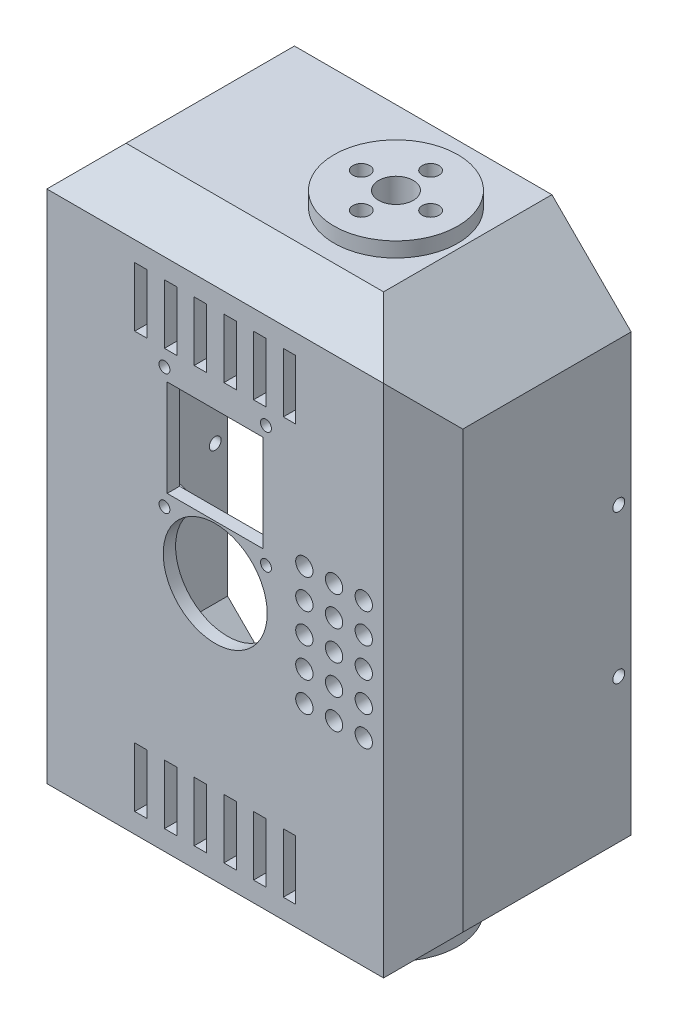
from build123d import *

# Parameters (mm, degrees)
BOSS_1_DEPTH    = 42
CUT_2_DEPTH     = 86
CUT_3_DEPTH     = 86
CUT_4_DEPTH     = 122
CUT_5_DEPTH     = 122
CUT_6_DEPTH     = 31.6
CUT_7_DEPTH     = 4.1
CUT_8_DEPTH     = 4.1
S_CUT9_W        = 2.5
S_CUT9_H        = 12
POCKET_9_DEPTH  = 2.7
S_CUT10_W       = 2.5
S_CUT10_H       = 12
POCKET_10_DEPTH = 2.7
S_CUT11_W       = 2.5
S_CUT11_H       = 12
POCKET_11_DEPTH = 2.7
S_CUT12_W       = 2.5
S_CUT12_H       = 12
POCKET_12_DEPTH = 2.7
S_CUT13_W       = 2.5
S_CUT13_H       = 12
POCKET_13_DEPTH = 2.7
S_CUT14_W       = 2.5
S_CUT14_H       = 12
POCKET_14_DEPTH = 2.7
S_HOLE15_R      = 1.2
HOLE_15_DEPTH   = 2.7
S_HOLE16_R      = 1.2
HOLE_16_DEPTH   = 2.7
S_CUT17_W       = 2.5
S_CUT17_H       = 12
POCKET_17_DEPTH = 2.7
S_CUT18_W       = 2.5
S_CUT18_H       = 12
POCKET_18_DEPTH = 2.7
S_CUT19_W       = 2.5
S_CUT19_H       = 12
POCKET_19_DEPTH = 2.7
S_CUT20_W       = 2.5
S_CUT20_H       = 12
POCKET_20_DEPTH = 2.7
S_CUT21_W       = 2.5
S_CUT21_H       = 12
POCKET_21_DEPTH = 2.7
S_CUT22_W       = 2.5
S_CUT22_H       = 12
POCKET_22_DEPTH = 2.7
S_HOLE23_R      = 1.2
HOLE_23_DEPTH   = 2.7
S_HOLE24_R      = 1.2
HOLE_24_DEPTH   = 2.7
S_HOLE25_R      = 1.75
HOLE_25_DEPTH   = 2.7
S_HOLE26_R      = 1.75
HOLE_26_DEPTH   = 2.7
S_HOLE27_R      = 1.75
HOLE_27_DEPTH   = 2.7
S_HOLE28_R      = 1.75
HOLE_28_DEPTH   = 2.7
S_HOLE29_R      = 1.75
HOLE_29_DEPTH   = 2.7
S_HOLE30_R      = 1.75
HOLE_30_DEPTH   = 2.7
S_HOLE31_R      = 1.75
HOLE_31_DEPTH   = 2.7
S_HOLE32_R      = 1.75
HOLE_32_DEPTH   = 2.7
S_HOLE33_R      = 1.75
HOLE_33_DEPTH   = 2.7
S_HOLE34_R      = 1.75
HOLE_34_DEPTH   = 2.7
S_HOLE35_R      = 1.75
HOLE_35_DEPTH   = 2.7
S_HOLE36_R      = 1.75
HOLE_36_DEPTH   = 2.7
S_HOLE37_R      = 1.75
HOLE_37_DEPTH   = 2.7
S_HOLE38_R      = 1.75
HOLE_38_DEPTH   = 2.7
S_HOLE39_R      = 1.75
HOLE_39_DEPTH   = 2.7
S_CYL40_R       = 12.5
BOSS_40_DEPTH   = 6
S_CYL41_R       = 12.5
BOSS_41_DEPTH   = 6
S_CYL42_R       = 2.5
BOSS_42_DEPTH   = 2
S_CYL43_R       = 2.5
BOSS_43_DEPTH   = 2
S_CYL44_R       = 2.5
BOSS_44_DEPTH   = 2
S_CYL45_R       = 2.5
BOSS_45_DEPTH   = 2
S_HOLE46_R      = 3.5
HOLE_46_DEPTH   = 6.2
S_HOLE47_R      = 1.7
HOLE_47_DEPTH   = 6.2
S_HOLE48_R      = 1.7
HOLE_48_DEPTH   = 6.2
S_HOLE49_R      = 1.7
HOLE_49_DEPTH   = 6.2
S_HOLE50_R      = 1.7
HOLE_50_DEPTH   = 6.2
S_HOLE51_R      = 3.2
HOLE_51_DEPTH   = 3.1
S_HOLE52_R      = 3.2
HOLE_52_DEPTH   = 3.1
S_HOLE53_R      = 3.2
HOLE_53_DEPTH   = 3.1
S_HOLE54_R      = 3.2
HOLE_54_DEPTH   = 3.1
S_HOLE55_R      = 3.5
HOLE_55_DEPTH   = 6.2
S_HOLE56_R      = 1.7
HOLE_56_DEPTH   = 6.2
S_HOLE57_R      = 1.7
HOLE_57_DEPTH   = 6.2
S_HOLE58_R      = 1.7
HOLE_58_DEPTH   = 6.2
S_HOLE59_R      = 1.7
HOLE_59_DEPTH   = 6.2
S_HOLE60_R      = 3.2
HOLE_60_DEPTH   = 3.1
S_HOLE61_R      = 3.2
HOLE_61_DEPTH   = 3.1
S_HOLE62_R      = 3.2
HOLE_62_DEPTH   = 3.1
S_HOLE63_R      = 3.2
HOLE_63_DEPTH   = 3.1
S_HOLE64_R      = 10.5
HOLE_64_DEPTH   = 6.1
S_CUT65_W       = 19.4
S_CUT65_H       = 19.5
POCKET_65_DEPTH = 6.1
S_HOLE66_R      = 1.1
HOLE_66_DEPTH   = 3.2
S_HOLE67_R      = 1.1
HOLE_67_DEPTH   = 3.2
S_HOLE68_R      = 1.1
HOLE_68_DEPTH   = 3.2
S_HOLE69_R      = 1.1
HOLE_69_DEPTH   = 3.2


with BuildPart() as part:
    # S_prism1 → Boss_1 (new body)
    with BuildSketch(Plane.XY.offset(168)):
        Polygon((42, -44), (42, 44), (26, 60), (-26, 60), (-42, 44), (-42, -44), (-26, -60), (26, -60), align=None)
    extrude(amount=BOSS_1_DEPTH)

    # S_pcut2 → Cut_2 (cut)
    with BuildSketch(Plane(origin=(-43, 0, 0), x_dir=(0, 0, -1), z_dir=(1, 0, 0))):
        Polygon((-210.6, 60.6), (-210.6, 51.4), (-201.4, 60.6), align=None)
    extrude(amount=CUT_2_DEPTH, mode=Mode.SUBTRACT)

    # S_pcut3 → Cut_3 (cut)
    with BuildSketch(Plane(origin=(-43, 0, 0), x_dir=(0, 0, -1), z_dir=(1, 0, 0))):
        Polygon((-210.6, -60.6), (-210.6, -51.4), (-201.4, -60.6), align=None)
    extrude(amount=CUT_3_DEPTH, mode=Mode.SUBTRACT)

    # S_pcut4 → Cut_4 (cut)
    with BuildSketch(Plane(origin=(0, -61, 0), x_dir=(1, 0, 0), z_dir=(0, 1, 0))):
        Polygon((42.6, -210.6), (33.4, -210.6), (42.6, -201.4), align=None)
    extrude(amount=CUT_4_DEPTH, mode=Mode.SUBTRACT)

    # S_pcut5 → Cut_5 (cut)
    with BuildSketch(Plane(origin=(0, -61, 0), x_dir=(1, 0, 0), z_dir=(0, 1, 0))):
        Polygon((-42.6, -210.6), (-33.4, -210.6), (-42.6, -201.4), align=None)
    extrude(amount=CUT_5_DEPTH, mode=Mode.SUBTRACT)

    # S_pcut6 → Cut_6 (cut)
    with BuildSketch(Plane.XY.offset(167.9)):
        Polygon((39.5, -42.964466094), (39.5, 42.964466094), (24.964466094, 57.5), (-24.964466094, 57.5), (-39.5, 42.964466094), (-39.5, -42.964466094), (-24.964466094, -57.5), (24.964466094, -57.5), align=None)
    extrude(amount=CUT_6_DEPTH, mode=Mode.SUBTRACT)

    # S_pcut7 → Cut_7 (cut)
    with BuildSketch(Plane.XY.offset(199.4)):
        Polygon((35.5, -41.307611845), (35.5, 41.307611845), (23.307611845, 53.5), (-23.307611845, 53.5), (-35.5, 41.307611845), (-35.5, -41.307611845), (-23.307611845, -53.5), (23.307611845, -53.5), align=None)
    extrude(amount=CUT_7_DEPTH, mode=Mode.SUBTRACT)

    # S_pcut8 → Cut_8 (cut)
    with BuildSketch(Plane.XY.offset(203.4)):
        Polygon((31.5, -39.650757595), (31.5, 39.650757595), (21.650757595, 49.5), (-21.650757595, 49.5), (-31.5, 39.650757595), (-31.5, -39.650757595), (-21.650757595, -49.5), (21.650757595, -49.5), align=None)
    extrude(amount=CUT_8_DEPTH, mode=Mode.SUBTRACT)

    # S_cut9 → Pocket_9 (cut)
    with BuildSketch(Plane.XY.offset(207.4)):
        with Locations((-15, 42)):
            Rectangle(S_CUT9_W, S_CUT9_H)
    extrude(amount=POCKET_9_DEPTH, mode=Mode.SUBTRACT)

    # S_cut10 → Pocket_10 (cut)
    with BuildSketch(Plane.XY.offset(207.4)):
        with Locations((-9, 42)):
            Rectangle(S_CUT10_W, S_CUT10_H)
    extrude(amount=POCKET_10_DEPTH, mode=Mode.SUBTRACT)

    # S_cut11 → Pocket_11 (cut)
    with BuildSketch(Plane.XY.offset(207.4)):
        with Locations((-3, 42)):
            Rectangle(S_CUT11_W, S_CUT11_H)
    extrude(amount=POCKET_11_DEPTH, mode=Mode.SUBTRACT)

    # S_cut12 → Pocket_12 (cut)
    with BuildSketch(Plane.XY.offset(207.4)):
        with Locations((3, 42)):
            Rectangle(S_CUT12_W, S_CUT12_H)
    extrude(amount=POCKET_12_DEPTH, mode=Mode.SUBTRACT)

    # S_cut13 → Pocket_13 (cut)
    with BuildSketch(Plane.XY.offset(207.4)):
        with Locations((9, 42)):
            Rectangle(S_CUT13_W, S_CUT13_H)
    extrude(amount=POCKET_13_DEPTH, mode=Mode.SUBTRACT)

    # S_cut14 → Pocket_14 (cut)
    with BuildSketch(Plane.XY.offset(207.4)):
        with Locations((15, 42)):
            Rectangle(S_CUT14_W, S_CUT14_H)
    extrude(amount=POCKET_14_DEPTH, mode=Mode.SUBTRACT)

    # S_hole15 → Hole_15 (cut)
    with BuildSketch(Plane(origin=(39.4, 0, 0), x_dir=(0, 0, -1), z_dir=(1, 0, 0))):
        with Locations((-170.5, -15)):
            Circle(S_HOLE15_R)
    extrude(amount=HOLE_15_DEPTH, mode=Mode.SUBTRACT)

    # S_hole16 → Hole_16 (cut)
    with BuildSketch(Plane(origin=(39.4, 0, 0), x_dir=(0, 0, -1), z_dir=(1, 0, 0))):
        with Locations((-170.5, 15)):
            Circle(S_HOLE16_R)
    extrude(amount=HOLE_16_DEPTH, mode=Mode.SUBTRACT)

    # S_cut17 → Pocket_17 (cut)
    with BuildSketch(Plane.XY.offset(207.4)):
        with Locations((-15, -42)):
            Rectangle(S_CUT17_W, S_CUT17_H)
    extrude(amount=POCKET_17_DEPTH, mode=Mode.SUBTRACT)

    # S_cut18 → Pocket_18 (cut)
    with BuildSketch(Plane.XY.offset(207.4)):
        with Locations((-9, -42)):
            Rectangle(S_CUT18_W, S_CUT18_H)
    extrude(amount=POCKET_18_DEPTH, mode=Mode.SUBTRACT)

    # S_cut19 → Pocket_19 (cut)
    with BuildSketch(Plane.XY.offset(207.4)):
        with Locations((-3, -42)):
            Rectangle(S_CUT19_W, S_CUT19_H)
    extrude(amount=POCKET_19_DEPTH, mode=Mode.SUBTRACT)

    # S_cut20 → Pocket_20 (cut)
    with BuildSketch(Plane.XY.offset(207.4)):
        with Locations((3, -42)):
            Rectangle(S_CUT20_W, S_CUT20_H)
    extrude(amount=POCKET_20_DEPTH, mode=Mode.SUBTRACT)

    # S_cut21 → Pocket_21 (cut)
    with BuildSketch(Plane.XY.offset(207.4)):
        with Locations((9, -42)):
            Rectangle(S_CUT21_W, S_CUT21_H)
    extrude(amount=POCKET_21_DEPTH, mode=Mode.SUBTRACT)

    # S_cut22 → Pocket_22 (cut)
    with BuildSketch(Plane.XY.offset(207.4)):
        with Locations((15, -42)):
            Rectangle(S_CUT22_W, S_CUT22_H)
    extrude(amount=POCKET_22_DEPTH, mode=Mode.SUBTRACT)

    # S_hole23 → Hole_23 (cut)
    with BuildSketch(Plane(origin=(-42.1, 0, 0), x_dir=(0, 0, -1), z_dir=(1, 0, 0))):
        with Locations((-170.5, -15)):
            Circle(S_HOLE23_R)
    extrude(amount=HOLE_23_DEPTH, mode=Mode.SUBTRACT)

    # S_hole24 → Hole_24 (cut)
    with BuildSketch(Plane(origin=(-42.1, 0, 0), x_dir=(0, 0, -1), z_dir=(1, 0, 0))):
        with Locations((-170.5, 15)):
            Circle(S_HOLE24_R)
    extrude(amount=HOLE_24_DEPTH, mode=Mode.SUBTRACT)

    # S_hole25 → Hole_25 (cut)
    with BuildSketch(Plane.XY.offset(207.4)):
        with Locations((18, -12)):
            Circle(S_HOLE25_R)
    extrude(amount=HOLE_25_DEPTH, mode=Mode.SUBTRACT)

    # S_hole26 → Hole_26 (cut)
    with BuildSketch(Plane.XY.offset(207.4)):
        with Locations((18, -6)):
            Circle(S_HOLE26_R)
    extrude(amount=HOLE_26_DEPTH, mode=Mode.SUBTRACT)

    # S_hole27 → Hole_27 (cut)
    with BuildSketch(Plane.XY.offset(207.4)):
        with Locations((18, 0)):
            Circle(S_HOLE27_R)
    extrude(amount=HOLE_27_DEPTH, mode=Mode.SUBTRACT)

    # S_hole28 → Hole_28 (cut)
    with BuildSketch(Plane.XY.offset(207.4)):
        with Locations((18, 6)):
            Circle(S_HOLE28_R)
    extrude(amount=HOLE_28_DEPTH, mode=Mode.SUBTRACT)

    # S_hole29 → Hole_29 (cut)
    with BuildSketch(Plane.XY.offset(207.4)):
        with Locations((18, 12)):
            Circle(S_HOLE29_R)
    extrude(amount=HOLE_29_DEPTH, mode=Mode.SUBTRACT)

    # S_hole30 → Hole_30 (cut)
    with BuildSketch(Plane.XY.offset(207.4)):
        with Locations((24, -12)):
            Circle(S_HOLE30_R)
    extrude(amount=HOLE_30_DEPTH, mode=Mode.SUBTRACT)

    # S_hole31 → Hole_31 (cut)
    with BuildSketch(Plane.XY.offset(207.4)):
        with Locations((24, -6)):
            Circle(S_HOLE31_R)
    extrude(amount=HOLE_31_DEPTH, mode=Mode.SUBTRACT)

    # S_hole32 → Hole_32 (cut)
    with BuildSketch(Plane.XY.offset(207.4)):
        with Locations((24, 0)):
            Circle(S_HOLE32_R)
    extrude(amount=HOLE_32_DEPTH, mode=Mode.SUBTRACT)

    # S_hole33 → Hole_33 (cut)
    with BuildSketch(Plane.XY.offset(207.4)):
        with Locations((24, 6)):
            Circle(S_HOLE33_R)
    extrude(amount=HOLE_33_DEPTH, mode=Mode.SUBTRACT)

    # S_hole34 → Hole_34 (cut)
    with BuildSketch(Plane.XY.offset(207.4)):
        with Locations((24, 12)):
            Circle(S_HOLE34_R)
    extrude(amount=HOLE_34_DEPTH, mode=Mode.SUBTRACT)

    # S_hole35 → Hole_35 (cut)
    with BuildSketch(Plane.XY.offset(207.4)):
        with Locations((30, -12)):
            Circle(S_HOLE35_R)
    extrude(amount=HOLE_35_DEPTH, mode=Mode.SUBTRACT)

    # S_hole36 → Hole_36 (cut)
    with BuildSketch(Plane.XY.offset(207.4)):
        with Locations((30, -6)):
            Circle(S_HOLE36_R)
    extrude(amount=HOLE_36_DEPTH, mode=Mode.SUBTRACT)

    # S_hole37 → Hole_37 (cut)
    with BuildSketch(Plane.XY.offset(207.4)):
        with Locations((30, 0)):
            Circle(S_HOLE37_R)
    extrude(amount=HOLE_37_DEPTH, mode=Mode.SUBTRACT)

    # S_hole38 → Hole_38 (cut)
    with BuildSketch(Plane.XY.offset(207.4)):
        with Locations((30, 6)):
            Circle(S_HOLE38_R)
    extrude(amount=HOLE_38_DEPTH, mode=Mode.SUBTRACT)

    # S_hole39 → Hole_39 (cut)
    with BuildSketch(Plane.XY.offset(207.4)):
        with Locations((30, 12)):
            Circle(S_HOLE39_R)
    extrude(amount=HOLE_39_DEPTH, mode=Mode.SUBTRACT)

    # S_cyl40 → Boss_40 (add)
    with BuildSketch(Plane(origin=(0, 57, 0), x_dir=(1, 0, 0), z_dir=(0, 1, 0))):
        with Locations((12.5, -186)):
            Circle(S_CYL40_R)
    extrude(amount=BOSS_40_DEPTH)

    # S_cyl41 → Boss_41 (add)
    with BuildSketch(Plane(origin=(0, -63, 0), x_dir=(1, 0, 0), z_dir=(0, 1, 0))):
        with Locations((12.5, -186)):
            Circle(S_CYL41_R)
    extrude(amount=BOSS_41_DEPTH)

    # S_cyl42 → Boss_42 (add)
    with BuildSketch(Plane.XY.offset(207)):
        with Locations((-10.25, 8.3)):
            Circle(S_CYL42_R)
    extrude(amount=BOSS_42_DEPTH)

    # S_cyl43 → Boss_43 (add)
    with BuildSketch(Plane.XY.offset(207)):
        with Locations((10.25, 8.3)):
            Circle(S_CYL43_R)
    extrude(amount=BOSS_43_DEPTH)

    # S_cyl44 → Boss_44 (add)
    with BuildSketch(Plane.XY.offset(207)):
        with Locations((-10.25, 32.75)):
            Circle(S_CYL44_R)
    extrude(amount=BOSS_44_DEPTH)

    # S_cyl45 → Boss_45 (add)
    with BuildSketch(Plane.XY.offset(207)):
        with Locations((10.25, 32.75)):
            Circle(S_CYL45_R)
    extrude(amount=BOSS_45_DEPTH)

    # S_hole46 → Hole_46 (cut)
    with BuildSketch(Plane(origin=(0, 56.9, 0), x_dir=(1, 0, 0), z_dir=(0, 1, 0))):
        with Locations((12.5, -186)):
            Circle(S_HOLE46_R)
    extrude(amount=HOLE_46_DEPTH, mode=Mode.SUBTRACT)

    # S_hole47 → Hole_47 (cut)
    with BuildSketch(Plane(origin=(0, 56.9, 0), x_dir=(1, 0, 0), z_dir=(0, 1, 0))):
        with Locations((19.5, -186)):
            Circle(S_HOLE47_R)
    extrude(amount=HOLE_47_DEPTH, mode=Mode.SUBTRACT)

    # S_hole48 → Hole_48 (cut)
    with BuildSketch(Plane(origin=(0, 56.9, 0), x_dir=(1, 0, 0), z_dir=(0, 1, 0))):
        with Locations((12.5, -193)):
            Circle(S_HOLE48_R)
    extrude(amount=HOLE_48_DEPTH, mode=Mode.SUBTRACT)

    # S_hole49 → Hole_49 (cut)
    with BuildSketch(Plane(origin=(0, 56.9, 0), x_dir=(1, 0, 0), z_dir=(0, 1, 0))):
        with Locations((5.5, -186)):
            Circle(S_HOLE49_R)
    extrude(amount=HOLE_49_DEPTH, mode=Mode.SUBTRACT)

    # S_hole50 → Hole_50 (cut)
    with BuildSketch(Plane(origin=(0, 56.9, 0), x_dir=(1, 0, 0), z_dir=(0, 1, 0))):
        with Locations((12.5, -179)):
            Circle(S_HOLE50_R)
    extrude(amount=HOLE_50_DEPTH, mode=Mode.SUBTRACT)

    # S_hole51 → Hole_51 (cut)
    with BuildSketch(Plane(origin=(0, 56.9, 0), x_dir=(1, 0, 0), z_dir=(0, 1, 0))):
        with Locations((19.5, -186)):
            Circle(S_HOLE51_R)
    extrude(amount=HOLE_51_DEPTH, mode=Mode.SUBTRACT)

    # S_hole52 → Hole_52 (cut)
    with BuildSketch(Plane(origin=(0, 56.9, 0), x_dir=(1, 0, 0), z_dir=(0, 1, 0))):
        with Locations((12.5, -193)):
            Circle(S_HOLE52_R)
    extrude(amount=HOLE_52_DEPTH, mode=Mode.SUBTRACT)

    # S_hole53 → Hole_53 (cut)
    with BuildSketch(Plane(origin=(0, 56.9, 0), x_dir=(1, 0, 0), z_dir=(0, 1, 0))):
        with Locations((5.5, -186)):
            Circle(S_HOLE53_R)
    extrude(amount=HOLE_53_DEPTH, mode=Mode.SUBTRACT)

    # S_hole54 → Hole_54 (cut)
    with BuildSketch(Plane(origin=(0, 56.9, 0), x_dir=(1, 0, 0), z_dir=(0, 1, 0))):
        with Locations((12.5, -179)):
            Circle(S_HOLE54_R)
    extrude(amount=HOLE_54_DEPTH, mode=Mode.SUBTRACT)

    # S_hole55 → Hole_55 (cut)
    with BuildSketch(Plane(origin=(0, -63.1, 0), x_dir=(1, 0, 0), z_dir=(0, 1, 0))):
        with Locations((12.5, -186)):
            Circle(S_HOLE55_R)
    extrude(amount=HOLE_55_DEPTH, mode=Mode.SUBTRACT)

    # S_hole56 → Hole_56 (cut)
    with BuildSketch(Plane(origin=(0, -63.1, 0), x_dir=(1, 0, 0), z_dir=(0, 1, 0))):
        with Locations((19.5, -186)):
            Circle(S_HOLE56_R)
    extrude(amount=HOLE_56_DEPTH, mode=Mode.SUBTRACT)

    # S_hole57 → Hole_57 (cut)
    with BuildSketch(Plane(origin=(0, -63.1, 0), x_dir=(1, 0, 0), z_dir=(0, 1, 0))):
        with Locations((12.5, -193)):
            Circle(S_HOLE57_R)
    extrude(amount=HOLE_57_DEPTH, mode=Mode.SUBTRACT)

    # S_hole58 → Hole_58 (cut)
    with BuildSketch(Plane(origin=(0, -63.1, 0), x_dir=(1, 0, 0), z_dir=(0, 1, 0))):
        with Locations((5.5, -186)):
            Circle(S_HOLE58_R)
    extrude(amount=HOLE_58_DEPTH, mode=Mode.SUBTRACT)

    # S_hole59 → Hole_59 (cut)
    with BuildSketch(Plane(origin=(0, -63.1, 0), x_dir=(1, 0, 0), z_dir=(0, 1, 0))):
        with Locations((12.5, -179)):
            Circle(S_HOLE59_R)
    extrude(amount=HOLE_59_DEPTH, mode=Mode.SUBTRACT)

    # S_hole60 → Hole_60 (cut)
    with BuildSketch(Plane(origin=(0, -60, 0), x_dir=(1, 0, 0), z_dir=(0, 1, 0))):
        with Locations((19.5, -186)):
            Circle(S_HOLE60_R)
    extrude(amount=HOLE_60_DEPTH, mode=Mode.SUBTRACT)

    # S_hole61 → Hole_61 (cut)
    with BuildSketch(Plane(origin=(0, -60, 0), x_dir=(1, 0, 0), z_dir=(0, 1, 0))):
        with Locations((12.5, -193)):
            Circle(S_HOLE61_R)
    extrude(amount=HOLE_61_DEPTH, mode=Mode.SUBTRACT)

    # S_hole62 → Hole_62 (cut)
    with BuildSketch(Plane(origin=(0, -60, 0), x_dir=(1, 0, 0), z_dir=(0, 1, 0))):
        with Locations((5.5, -186)):
            Circle(S_HOLE62_R)
    extrude(amount=HOLE_62_DEPTH, mode=Mode.SUBTRACT)

    # S_hole63 → Hole_63 (cut)
    with BuildSketch(Plane(origin=(0, -60, 0), x_dir=(1, 0, 0), z_dir=(0, 1, 0))):
        with Locations((12.5, -179)):
            Circle(S_HOLE63_R)
    extrude(amount=HOLE_63_DEPTH, mode=Mode.SUBTRACT)

    # S_hole64 → Hole_64 (cut)
    with BuildSketch(Plane.XY.offset(204)):
        Circle(S_HOLE64_R)
    extrude(amount=HOLE_64_DEPTH, mode=Mode.SUBTRACT)

    # S_cut65 → Pocket_65 (cut)
    with BuildSketch(Plane.XY.offset(204)):
        with Locations((0, 20.65)):
            Rectangle(S_CUT65_W, S_CUT65_H)
    extrude(amount=POCKET_65_DEPTH, mode=Mode.SUBTRACT)

    # S_hole66 → Hole_66 (cut)
    with BuildSketch(Plane.XY.offset(206.9)):
        with Locations((-10.25, 8.3)):
            Circle(S_HOLE66_R)
    extrude(amount=HOLE_66_DEPTH, mode=Mode.SUBTRACT)

    # S_hole67 → Hole_67 (cut)
    with BuildSketch(Plane.XY.offset(206.9)):
        with Locations((10.25, 8.3)):
            Circle(S_HOLE67_R)
    extrude(amount=HOLE_67_DEPTH, mode=Mode.SUBTRACT)

    # S_hole68 → Hole_68 (cut)
    with BuildSketch(Plane.XY.offset(206.9)):
        with Locations((-10.25, 32.75)):
            Circle(S_HOLE68_R)
    extrude(amount=HOLE_68_DEPTH, mode=Mode.SUBTRACT)

    # S_hole69 → Hole_69 (cut)
    with BuildSketch(Plane.XY.offset(206.9)):
        with Locations((10.25, 32.75)):
            Circle(S_HOLE69_R)
    extrude(amount=HOLE_69_DEPTH, mode=Mode.SUBTRACT)


solid = part.part
